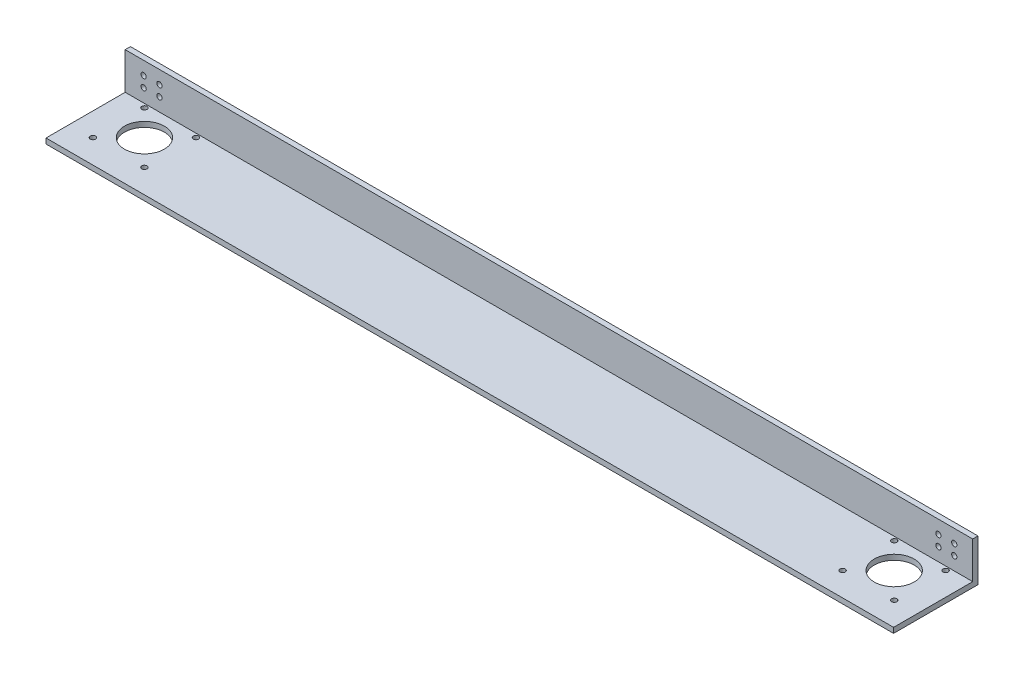
from build123d import *

# Parameters (mm, degrees)
BOSS_EXTRUDE1_DEPTH              = 510
TOPHOLES_SKETCH2_R               = 12
TOPHOLES_SKETCH2_R_2             = 1.5875
TOPHOLES_CUT_EXTRUDE1_DEPTH      = 514.005448923
BACKSIDEHOLES_SKETCH3_R          = 1.5875
BACKSIDEHOLES_CUT_EXTRUDE2_DEPTH = 514.152803753


with BuildPart() as part:
    # Sketch1 → Boss-Extrude1 (new body)
    with BuildSketch(Plane(origin=(0, 0, 0), x_dir=(0, 0, -1), z_dir=(1, 0, 0))):
        Polygon((0, 0), (-50.8, 0), (-50.8, 3.175), (-3.175, 3.175), (-3.175, 25.4), (0, 25.4), align=None)
    extrude(amount=BOSS_EXTRUDE1_DEPTH)

    # TopHoles-Sketch2 → TopHoles-Cut-Extrude1 (cut, through all)
    with BuildSketch(Plane(origin=(0, 3.175, 0), x_dir=(1, 0, 0), z_dir=(0, 1, 0))):
        with Locations((29.425, -21)):
            Circle(TOPHOLES_SKETCH2_R)
        with Locations((480.575, -21)):
            Circle(TOPHOLES_SKETCH2_R)
        with Locations((13.925, -5.5)):
            Circle(TOPHOLES_SKETCH2_R_2)
        with Locations((44.925, -5.5)):
            Circle(TOPHOLES_SKETCH2_R_2)
        with Locations((465.075, -5.5)):
            Circle(TOPHOLES_SKETCH2_R_2)
        with Locations((496.075, -5.5)):
            Circle(TOPHOLES_SKETCH2_R_2)
        with Locations((13.925, -36.5)):
            Circle(TOPHOLES_SKETCH2_R_2)
        with Locations((44.925, -36.5)):
            Circle(TOPHOLES_SKETCH2_R_2)
        with Locations((465.075, -36.5)):
            Circle(TOPHOLES_SKETCH2_R_2)
        with Locations((496.075, -36.5)):
            Circle(TOPHOLES_SKETCH2_R_2)
    extrude(amount=-TOPHOLES_CUT_EXTRUDE1_DEPTH, mode=Mode.SUBTRACT)

    # BackSideHoles-Sketch3 → BackSideHoles-Cut-Extrude2 (cut, through all)
    with BuildSketch(Plane(origin=(0, 0, 0), x_dir=(-1, 0, 0), z_dir=(0, 0, -1))):
        with Locations((-498.8875, 17.4625)):
            Circle(BACKSIDEHOLES_SKETCH3_R)
        with Locations((-489.3625, 17.4625)):
            Circle(BACKSIDEHOLES_SKETCH3_R)
        with Locations((-498.8875, 11.1125)):
            Circle(BACKSIDEHOLES_SKETCH3_R)
        with Locations((-489.3625, 11.1125)):
            Circle(BACKSIDEHOLES_SKETCH3_R)
        with Locations((-11.1125, 11.1125)):
            Circle(BACKSIDEHOLES_SKETCH3_R)
        with Locations((-20.6375, 11.1125)):
            Circle(BACKSIDEHOLES_SKETCH3_R)
        with Locations((-20.6375, 17.4625)):
            Circle(BACKSIDEHOLES_SKETCH3_R)
        with Locations((-11.1125, 17.4625)):
            Circle(BACKSIDEHOLES_SKETCH3_R)
    extrude(amount=-BACKSIDEHOLES_CUT_EXTRUDE2_DEPTH, mode=Mode.SUBTRACT)


solid = part.part
